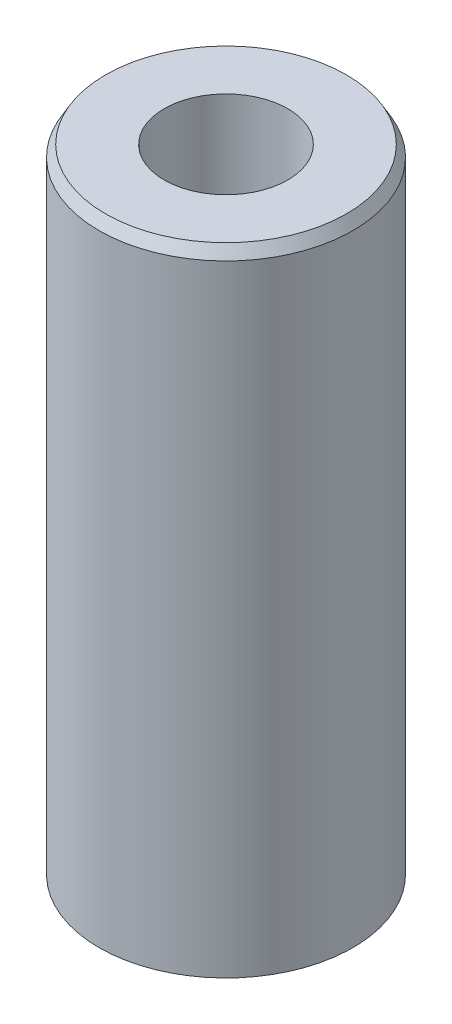
from build123d import *
from OCP.BRepFilletAPI import BRepFilletAPI_MakeChamfer

# Parameters (mm, degrees)
SKETCH1_R           = 20
BOSS_EXTRUDE1_DEPTH = 100.630889695
SKETCH2_R           = 9.736421084
CUT_EXTRUDE1_DEPTH  = 105.530263373
CHAMFER1_SIZE       = 1.775148299
CHAMFER1_SIZE2      = 1.024882348


with BuildPart() as part:
    # Sketch1 → Boss-Extrude1 (new body)
    with BuildSketch(Plane(origin=(0, 0, 0), x_dir=(1, 0, 0), z_dir=(0, 1, 0))):
        Circle(SKETCH1_R)
    extrude(amount=BOSS_EXTRUDE1_DEPTH)

    # Sketch2 → Cut-Extrude1 (cut, through all)
    with BuildSketch(Plane(origin=(0, 0, 0), x_dir=(1, 0, 0), z_dir=(0, 1, 0))):
        Circle(SKETCH2_R)
    extrude(amount=CUT_EXTRUDE1_DEPTH, mode=Mode.SUBTRACT)

    # Chamfer1: one chamfer whose edges measure the first distance from different faces: ONE call of the kernel's chamfer builder (chamfer() names one face for all edges)
    chamfer1_edges_1 = [part.edges().sort_by_distance(p)[0] for p in [
        (-20, 100.630889695, 0),
    ]]
    chamfer1_side_1 = [part.faces().sort_by_distance(p)[0] for p in [
        (-20, 50.315444848, 0),
    ]]
    chamfer1_edges_2 = [part.edges().sort_by_distance(p)[0] for p in [
        (-20, 0, 0),
    ]]
    chamfer1_side_2 = [part.faces().sort_by_distance(p)[0] for p in [
        (-19.434314575, 0, 0),
    ]]
    chamfer1 = BRepFilletAPI_MakeChamfer(part.part.solid().wrapped)
    for e in chamfer1_edges_1:
        chamfer1.Add(CHAMFER1_SIZE, CHAMFER1_SIZE2, e.wrapped, chamfer1_side_1[0].wrapped)  # the first distance lies on this face
    for e in chamfer1_edges_2:
        chamfer1.Add(CHAMFER1_SIZE, CHAMFER1_SIZE2, e.wrapped, chamfer1_side_2[0].wrapped)  # the first distance lies on this face
    add(Compound.cast(chamfer1.Shape()), mode=Mode.REPLACE)


solid = part.part
